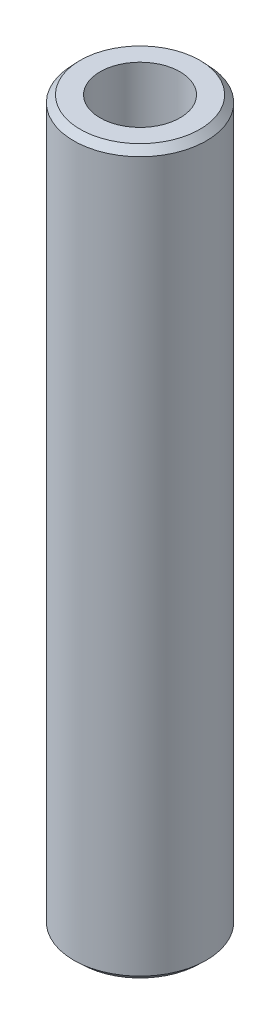
from build123d import *
from OCP.BRepFilletAPI import BRepFilletAPI_MakeChamfer

# Parameters (mm, degrees)
SKETCH1_R           = 55
BOSS_EXTRUDE1_DEPTH = 600
SKETCH2_R           = 33.176955377
CUT_EXTRUDE1_DEPTH  = 606.020660804
CHAMFER1_SIZE       = 5.64365091
CHAMFER1_SIZE2      = 5.337129126


with BuildPart() as part:
    # Sketch1 → Boss-Extrude1 (new body)
    with BuildSketch(Plane(origin=(0, 0, 0), x_dir=(1, 0, 0), z_dir=(0, 1, 0))):
        Circle(SKETCH1_R)
    extrude(amount=BOSS_EXTRUDE1_DEPTH)

    # Sketch2 → Cut-Extrude1 (cut, through all)
    with BuildSketch(Plane(origin=(0, 0, 0), x_dir=(1, 0, 0), z_dir=(0, 1, 0))):
        Circle(SKETCH2_R)
    extrude(amount=CUT_EXTRUDE1_DEPTH, mode=Mode.SUBTRACT)

    # Chamfer1: one chamfer whose edges measure the first distance from different faces: ONE call of the kernel's chamfer builder (chamfer() names one face for all edges)
    chamfer1_edges_1 = [part.edges().sort_by_distance(p)[0] for p in [
        (-55, 600, 0),
    ]]
    chamfer1_side_1 = [part.faces().sort_by_distance(p)[0] for p in [
        (-55, 300, 0),
    ]]
    chamfer1_edges_2 = [part.edges().sort_by_distance(p)[0] for p in [
        (-55, 0, 0),
    ]]
    chamfer1_side_2 = [part.faces().sort_by_distance(p)[0] for p in [
        (-53.444365081, 0, 0),
    ]]
    chamfer1 = BRepFilletAPI_MakeChamfer(part.part.solid().wrapped)
    for e in chamfer1_edges_1:
        chamfer1.Add(CHAMFER1_SIZE, CHAMFER1_SIZE2, e.wrapped, chamfer1_side_1[0].wrapped)  # the first distance lies on this face
    for e in chamfer1_edges_2:
        chamfer1.Add(CHAMFER1_SIZE, CHAMFER1_SIZE2, e.wrapped, chamfer1_side_2[0].wrapped)  # the first distance lies on this face
    add(Compound.cast(chamfer1.Shape()), mode=Mode.REPLACE)


solid = part.part
